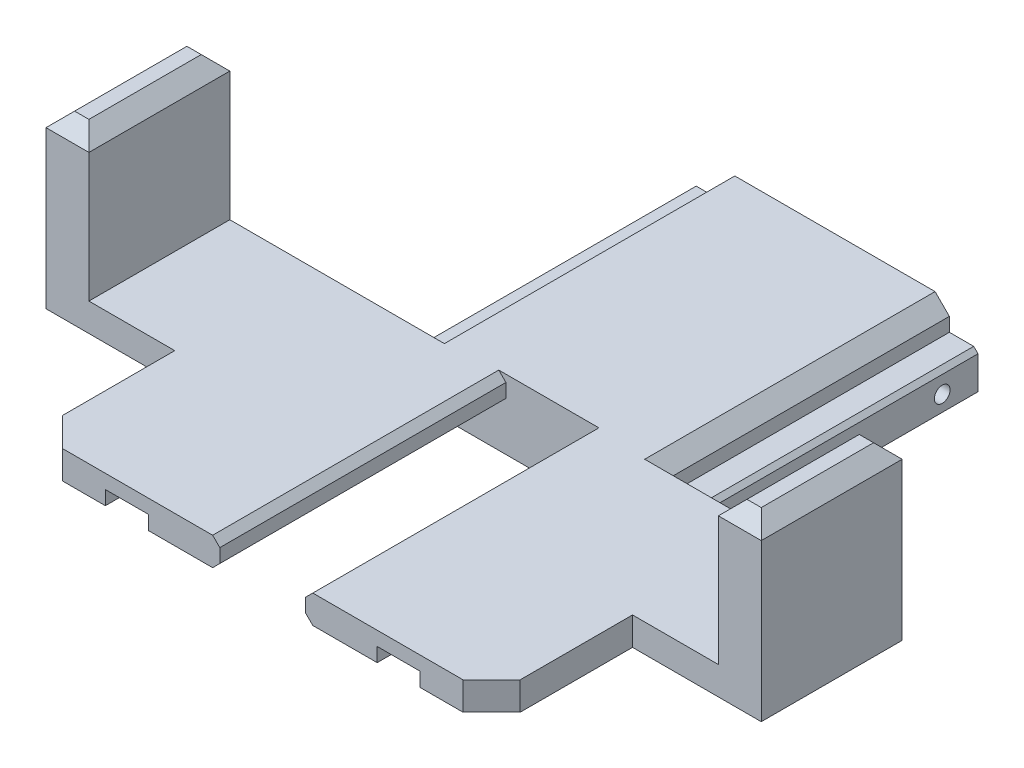
from build123d import *

# Parameters (mm, degrees)
EXTRUDE_1_DEPTH     = 20
SKETCH_2_R          = 0.55
CUT_EXTRUDE_1_DEPTH = 29.390183162
SKETCH_3_W          = 16
SKETCH_3_H          = 1.96468827
EXTRUDE_2_DEPTH     = 20
SKETCH_4_W          = 6
SKETCH_4_H          = 20
CUT_EXTRUDE_2_DEPTH = 42.332916665
SKETCH_6_W          = 19.7
SKETCH_6_H          = 1.96468827
EXTRUDE_13_DEPTH    = 17
SKETCH_7_W          = 19.7
SKETCH_7_H          = 1.96468827
EXTRUDE_14_DEPTH    = 17
SKETCH_8_W          = 3
SKETCH_8_H          = 9.85
EXTRUDE_15_DEPTH    = 10
CHAMFER_1_SIZE      = 0.3
SKETCH_10_W         = 3
SKETCH_10_H         = 0.982344135
CUT_EXTRUDE_3_DEPTH = 35.526692573
CHAMFER_3_SIZE      = 0.5
CHAMFER_4_DEPTH     = 20.3
CHAMFER_START       = 20.3
CHAMFER_4_2_DEPTH   = 20.7
CHAMFER_5_SIZE      = 1
CUT_EXTRUDE_4_DEPTH = 49.218253805
CHAMFER_6_SIZE      = 2


with BuildPart() as part:
    # 草图1 → 凸台-拉伸1 (new body)
    with BuildSketch(Plane.XY):
        Polygon((-10, 0.48531173), (-8, 0.48531173), (-8, 2.45), (8, 2.45), (8, 0.48531173), (10, 0.48531173), (10, -2.41468827), (-10, -2.41468827), align=None)
    extrude(amount=EXTRUDE_1_DEPTH)

    # 草图2 → 切除-拉伸1 (cut, through all)
    with BuildSketch(Plane(origin=(10, 0, 0), x_dir=(0, 0, -1), z_dir=(1, 0, 0))):
        with Locations(Location((-2.5, -1.01468827, 0), (0, 0, 90))):
            Circle(SKETCH_2_R)
        with Locations(Location((-18.5, -1.01468827, 0), (0, 0, 90))):
            Circle(SKETCH_2_R)
    extrude(amount=-CUT_EXTRUDE_1_DEPTH, mode=Mode.SUBTRACT)

    # 草图3 → 凸台-拉伸2 (add)
    with BuildSketch(Plane.XY.offset(20)):
        with Locations((0, 1.467655865)):
            Rectangle(SKETCH_3_W, SKETCH_3_H)
    extrude(amount=EXTRUDE_2_DEPTH)

    # 草图4 → 切除-拉伸2 (cut, through all)
    with BuildSketch(Plane.XZ.offset(-0.48531173)):
        with Locations((0, 30)):
            Rectangle(SKETCH_4_W, SKETCH_4_H)
    extrude(amount=-CUT_EXTRUDE_2_DEPTH, mode=Mode.SUBTRACT)

    # 草图6 → 凸台-拉伸13 (add)
    with BuildSketch(Plane.ZY.offset(8)):
        with Locations((30.15, 1.467655865)):
            Rectangle(SKETCH_6_W, SKETCH_6_H)
    extrude(amount=EXTRUDE_13_DEPTH)

    # 草图7 → 凸台-拉伸14 (add)
    with BuildSketch(Plane(origin=(8, 0, 0), x_dir=(0, 0, -1), z_dir=(1, 0, 0))):
        with Locations((-30.15, 1.467655865)):
            Rectangle(SKETCH_7_W, SKETCH_7_H)
    extrude(amount=EXTRUDE_14_DEPTH)

    # 草图8 → 凸台-拉伸15 (add)
    with BuildSketch(Plane(origin=(0, 2.45, 0), x_dir=(1, 0, 0), z_dir=(0, 1, 0))):
        with Locations((-23.5, -25.225)):
            Rectangle(SKETCH_8_W, SKETCH_8_H)
        with Locations((23.5, -25.225)):
            Rectangle(SKETCH_8_W, SKETCH_8_H)
    extrude(amount=EXTRUDE_15_DEPTH)

    # 倒角1
    chamfer_1_edges = [part.edges().sort_by_distance(p)[0] for p in [
        (10, -2.41468827, 10),
        (-10, -2.41468827, 10),
        (-10, 0.48531173, 10),
        (10, 0.48531173, 10),
    ]]
    chamfer(chamfer_1_edges, length=CHAMFER_1_SIZE)

    # 草图10 → 切除-拉伸3 (cut, through all)
    with BuildSketch(Plane(origin=(0, 0, 20.3), x_dir=(-1, 0, 0), z_dir=(0, 0, -1))):
        with Locations((-9.5, 0.976483798)):
            Rectangle(SKETCH_10_W, SKETCH_10_H)
        with Locations((9.5, 0.976483798)):
            Rectangle(SKETCH_10_W, SKETCH_10_H)
    extrude(amount=-CUT_EXTRUDE_3_DEPTH, mode=Mode.SUBTRACT)

    # 倒角3
    chamfer_3_edges = [part.edges().sort_by_distance(p)[0] for p in [
        (3, 2.45, 30),
        (-3, 2.45, 30),
        (-3, 0.48531173, 30),
        (3, 0.48531173, 30),
    ]]
    chamfer(chamfer_3_edges, length=CHAMFER_3_SIZE)

    # 倒角4: read off the stored shape, not the designer's step
    # 倒角4 outline → 倒角4 (cut)
    with BuildSketch(Plane.XY):
        Polygon((-8, 1.45), (-7, 2.45), (-8, 2.45), align=None)
        Polygon((8, 2.45), (7, 2.45), (8, 1.45), align=None)
    extrude(amount=CHAMFER_4_DEPTH, mode=Mode.SUBTRACT)

    # Chamfer 4 2 outline → Chamfer 4 2 (cut)
    with BuildSketch(Plane.XY.offset(CHAMFER_START)):
        Polygon((-8, 1.467655865), (-8, 1.45), (-7.982344135, 1.467655865), align=None)
        Polygon((8, 1.467655865), (7.982344135, 1.467655865), (8, 1.45), align=None)
    extrude(amount=CHAMFER_4_2_DEPTH, mode=Mode.SUBTRACT)

    # 倒角5
    chamfer_5_edges = [part.edges().sort_by_distance(p)[0] for p in [
        (23.5, 12.45, 20.3),
        (22, 12.45, 25.225),
        (23.5, 12.45, 30.15),
        (25, 12.45, 25.225),
        (-23.5, 12.45, 20.3),
        (-25, 12.45, 25.225),
        (-23.5, 12.45, 30.15),
        (-22, 12.45, 25.225),
    ]]
    chamfer(chamfer_5_edges, length=CHAMFER_5_SIZE)

    # 草图11 → 切除-拉伸4 (cut, through all)
    with BuildSketch(Plane(origin=(0, 2.45, 0), x_dir=(1, 0, 0), z_dir=(0, 1, 0))):
        Polygon((-22, -30.15), (-25, -30.15), (-25, -40), (-16, -40), (-16, -30.15), align=None)
        Polygon((16, -30.15), (16, -40), (25, -40), (25, -30.15), (22, -30.15), align=None)
    extrude(amount=-CUT_EXTRUDE_4_DEPTH, mode=Mode.SUBTRACT)

    # 倒角6
    chamfer_6_edges = [part.edges().sort_by_distance(p)[0] for p in [
        (-16, 1.467655865, 40),
        (16, 1.467655865, 40),
    ]]
    chamfer(chamfer_6_edges, length=CHAMFER_6_SIZE)


solid = part.part
